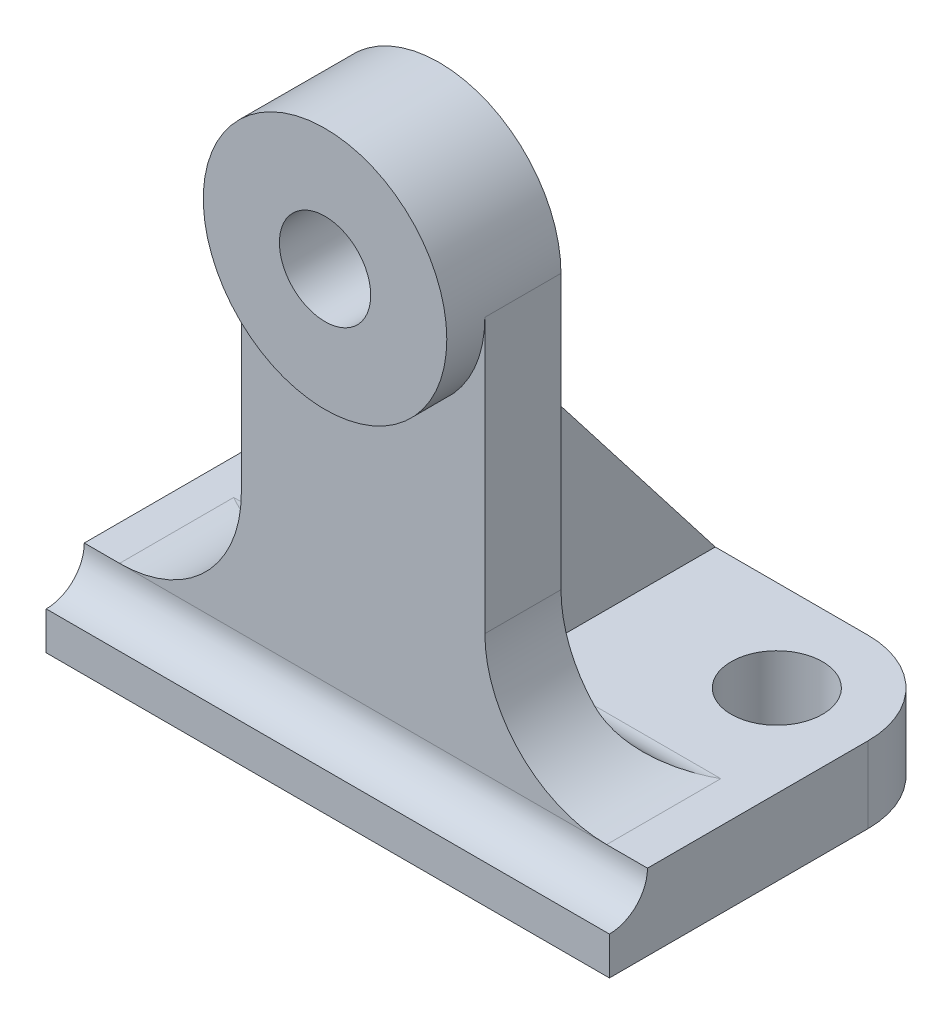
from build123d import *

# Parameters (mm, degrees)
SKETCH1_R            = 6
BOSS_EXTRUDE1_DEPTH  = 10
BOSS_EXTRUDE3_START  = 5
SKETCH2_R            = 16
SKETCH2_R_2          = 6
BOSS_EXTRUDE3_DEPTH  = 5
SKETCH3_W            = 74
SKETCH3_H            = 5
BOSS_EXTRUDE5_DEPTH  = 5
FILLET4_R            = 5
SKETCH5_W            = 74
SKETCH5_H            = 10
BOSS_EXTRUDE8_DEPTH  = 31
BOSS_EXTRUDE10_DEPTH = 40
CUT_EXTRUDE1_DEPTH   = 10
FILLET5_R            = 5
FILLET6_R            = 5
FILLET7_R            = 12
FILLET8_R            = 12
SKETCH16_R           = 6
CUT_EXTRUDE2_DEPTH   = 10
SKETCH17_R           = 6
CUT_EXTRUDE3_DEPTH   = 10


with BuildPart() as part:
    # Sketch1 → Boss-Extrude1 (new body)
    with BuildSketch(Plane.XY):
        with BuildLine():
            Line((-47.000970423, -51.805827164), (26.999029577, -51.805827164))
            Line((26.999029577, -51.805827164), (26.999029577, -41.805827164))
            Line((26.999029577, -41.805827164), (21.633436879, -41.805827164))
            ThreePointArc((21.633436879, -41.805827164), (10.31972838, -37.119535663), (5.633436879, -25.805827164))
            Line((5.633436879, -25.805827164), (5.633436879, 10.194172836))
            ThreePointArc((5.633436879, 10.194172836), (-10.366563121, 26.194172836), (-26.366563121, 10.194172836))
            Line((-26.366563121, 10.194172836), (-26.366563121, -25.805827164))
            ThreePointArc((-26.366563121, -25.805827164), (-31.052854622, -37.119535663), (-42.366563121, -41.805827164))
            Line((-42.366563121, -41.805827164), (-47.000970423, -41.805827164))
            Line((-47.000970423, -41.805827164), (-47.000970423, -51.805827164))
        make_face()
        with Locations((-10.366563121, 10.194172836)):
            Circle(SKETCH1_R, mode=Mode.SUBTRACT)
    extrude(amount=-BOSS_EXTRUDE1_DEPTH)

    # Sketch2 → Boss-Extrude3 (add)
    with BuildSketch(Plane.XY.offset(BOSS_EXTRUDE3_START)):
        with Locations((-10.366563121, 10.194172836)):
            Circle(SKETCH2_R)
        with Locations((-10.366563121, 10.194172836)):
            Circle(SKETCH2_R_2, mode=Mode.SUBTRACT)
    extrude(amount=-BOSS_EXTRUDE3_DEPTH)

    # Sketch3 → Boss-Extrude5 (add)
    with BuildSketch(Plane.XY):
        with Locations((-10.000970423, -49.305827164)):
            Rectangle(SKETCH3_W, SKETCH3_H)
    extrude(amount=BOSS_EXTRUDE5_DEPTH)

    # Fillet4
    fillet4_edges = [part.edges().sort_by_distance(p)[0] for p in [
        (-10.000970423, -46.805827164, 0),
    ]]
    fillet(fillet4_edges, radius=FILLET4_R - 0.0001)  # a hair under: the kernel refuses the full size

    # Sketch5 → Boss-Extrude8 (add)
    with BuildSketch(Plane(origin=(0, 0, -10), x_dir=(-1, 0, 0), z_dir=(0, 0, -1))):
        with Locations((10.000970423, -46.805827164)):
            Rectangle(SKETCH5_W, SKETCH5_H)
    extrude(amount=BOSS_EXTRUDE8_DEPTH)

    # Sketch13 → Boss-Extrude10 (add)
    with BuildSketch(Plane(origin=(0, -41.805827164, 0), x_dir=(1, 0, 0), z_dir=(0, 1, 0))):
        Polygon((-10.091769113, 41), (-15.091769113, 41), (-15.091769113, 10), (-5.091769113, 10), (-5.091769113, 41), align=None)
    extrude(amount=BOSS_EXTRUDE10_DEPTH)

    # Sketch14 → Cut-Extrude1 (cut)
    with BuildSketch(Plane.ZY.offset(15.091769113)):
        Polygon((-41, -41.805827164), (-10, -1.805827164), (-41, -1.805827164), align=None)
    extrude(amount=-CUT_EXTRUDE1_DEPTH, mode=Mode.SUBTRACT)

    # Fillet5
    fillet5_edges = [part.edges().sort_by_distance(p)[0] for p in [
        (-28.729166117, -41.805827164, -10),
    ]]
    fillet(fillet5_edges, radius=FILLET5_R)

    # Fillet6
    fillet6_edges = [part.edges().sort_by_distance(p)[0] for p in [
        (8.270833883, -41.805827164, -10),
    ]]
    fillet(fillet6_edges, radius=FILLET6_R)

    # Fillet7
    fillet7_edges = [part.edges().sort_by_distance(p)[0] for p in [
        (26.999029577, -46.805827164, -41),
    ]]
    fillet(fillet7_edges, radius=FILLET7_R)

    # Fillet8
    fillet8_edges = [part.edges().sort_by_distance(p)[0] for p in [
        (-47.000970423, -46.805827164, -41),
    ]]
    fillet(fillet8_edges, radius=FILLET8_R)

    # Sketch16 → Cut-Extrude2 (cut)
    with BuildSketch(Plane(origin=(0, -41.805827164, 0), x_dir=(1, 0, 0), z_dir=(0, 1, 0))):
        with Locations(Location((14.999029577, 29, 0), (0, 0, 270))):
            Circle(SKETCH16_R)
    extrude(amount=-CUT_EXTRUDE2_DEPTH, mode=Mode.SUBTRACT)

    # Sketch17 → Cut-Extrude3 (cut)
    with BuildSketch(Plane(origin=(0, -41.805827164, 0), x_dir=(1, 0, 0), z_dir=(0, 1, 0))):
        with Locations(Location((-35.000970423, 29, 0), (0, 0, 270))):
            Circle(SKETCH17_R)
    extrude(amount=-CUT_EXTRUDE3_DEPTH, mode=Mode.SUBTRACT)


solid = part.part
